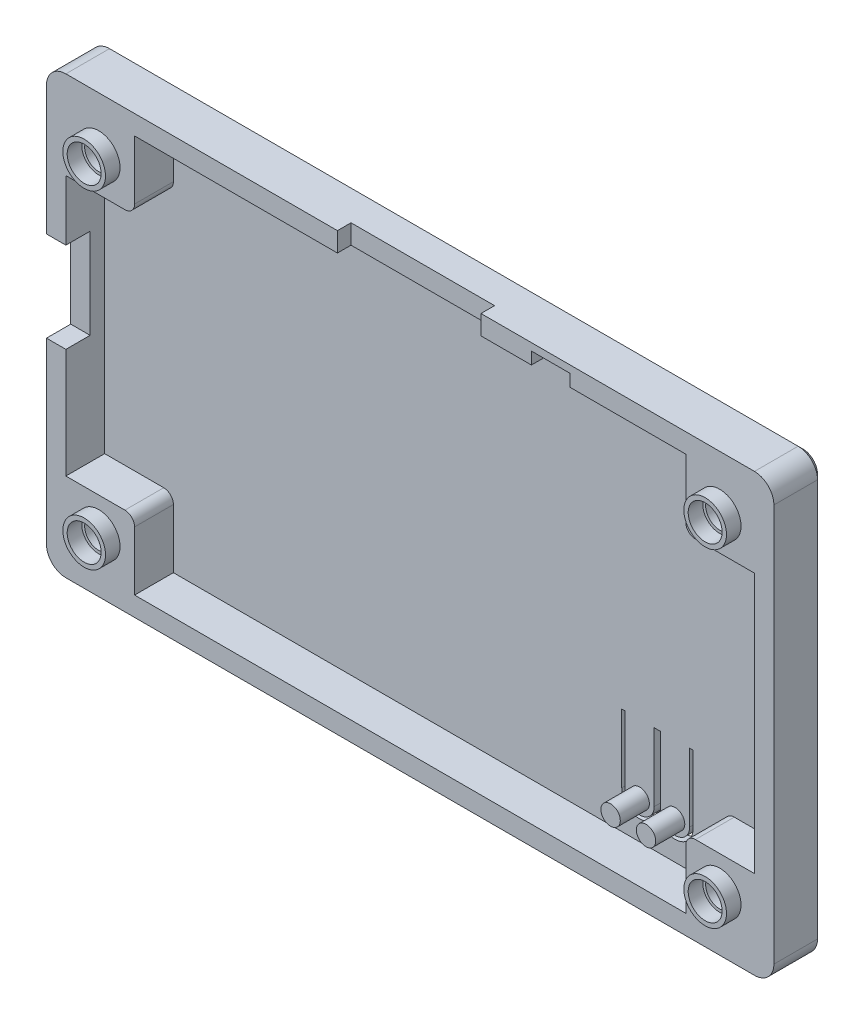
from build123d import *

# Parameters (mm, degrees)
SKICA1_W                  = 75
SKICA1_H                  = 45
P_IDAT_VYSUNUT_M1_DEPTH   = 13
SKICA2_W                  = 71
SKICA2_H                  = 41
ODEBRAT_VYSUNUT_M1_DEPTH  = 12
ZAOBLIT1_R                = 2
ZKOSEN_2_SIZE             = 0.5
SKICA4_W                  = 8.5
SKICA4_H                  = 8.5
P_IDAT_VYSUNUT_M2_DEPTH   = 4.22
ZAOBLIT2_R                = 1
SKICA6_W                  = 92.209043038
SKICA6_H                  = 16.914138174
ODEBRAT_VYSUNUT_M3_DEPTH  = 64.22
SKICA5_W                  = 10.08575576
SKICA5_H                  = 9.3
ODEBRAT_VYSUNUT_M4_DEPTH  = 10.5
SKICA7_W                  = 4
SKICA7_H                  = 7.545536299
ODEBRAT_VYSUNUT_M5_DEPTH  = 1.9
SKICA8_W                  = 14.8
SKICA8_H                  = 7.292326558
ODEBRAT_VYSUNUT_M6_DEPTH  = 1.4
SKICA9_R                  = 1.45
ODEBRAT_VYSUNUT_M7_DEPTH  = 5
SKICA10_R                 = 2.2
SKICA10_R_2               = 1.75
P_IDAT_VYSUNUT_M3_DEPTH   = 1.5
ODEBRAT_START             = -2
SKICA11_R                 = 2.925
SKICA11_R_2               = 1.45
ODEBRAT_VYSUNUT_M8_DEPTH  = 2
SKICA12_R                 = 1
P_IDAT_VYSUNUT_M4_DEPTH   = 3
ODEBRAT_VYSUNUT_M14_DEPTH = 1
ZKOSEN_3_SIZE             = 2
ZKOSEN_4_SIZE             = 2


with BuildPart() as part:
    # Skica1 → Přidat vysunutím1 (new body)
    with BuildSketch(Plane.XY):
        Rectangle(SKICA1_W, SKICA1_H)
    extrude(amount=P_IDAT_VYSUNUT_M1_DEPTH)

    # Skica2 → Odebrat vysunutím1 (cut)
    with BuildSketch(Plane.XY.offset(13)):
        Rectangle(SKICA2_W, SKICA2_H)
    extrude(amount=-ODEBRAT_VYSUNUT_M1_DEPTH, mode=Mode.SUBTRACT)

    # Zaoblit1
    zaoblit1_edges = [part.edges().sort_by_distance(p)[0] for p in [
        (35.5, 20.5, 7),
        (35.5, -20.5, 7),
        (-35.5, -20.5, 7),
        (-35.5, 20.5, 7),
        (37.5, -22.5, 6.5),
        (-37.5, -22.5, 6.5),
        (-37.5, 22.5, 6.5),
        (37.5, 22.5, 6.5),
    ]]
    fillet(zaoblit1_edges, radius=ZAOBLIT1_R)

    # Zkosení2
    zkosen_2_edges = [part.edges().sort_by_distance(p)[0] for p in [
        (0, 22.5, 0),
        (37.5, 0, 0),
        (0, -22.5, 0),
        (-37.5, 0, 0),
        (-36.914213562, 21.914213562, 0),
        (-36.914213562, -21.914213562, 0),
        (36.914213562, -21.914213562, 0),
        (36.914213562, 21.914213562, 0),
    ]]
    chamfer(zkosen_2_edges, length=ZKOSEN_2_SIZE)

    # Skica4 → Přidat vysunutím2 (add)
    with BuildSketch(Plane.XY.offset(1)):
        with Locations((-32.664213562, 17.664213562)):
            Rectangle(SKICA4_W, SKICA4_H)
        with Locations((-32.664213562, -17.664213562)):
            Rectangle(SKICA4_W, SKICA4_H)
        with Locations((32.664213562, -17.664213562)):
            Rectangle(SKICA4_W, SKICA4_H)
        with Locations((32.664213562, 17.664213562)):
            Rectangle(SKICA4_W, SKICA4_H)
    extrude(amount=P_IDAT_VYSUNUT_M2_DEPTH)

    # Zaoblit2
    zaoblit2_edges = [part.edges().sort_by_distance(p)[0] for p in [
        (-28.414213562, 13.414213562, 3.11),
        (-28.414213562, -13.414213562, 3.11),
        (28.414213562, -13.414213562, 3.11),
        (28.414213562, 13.414213562, 3.11),
    ]]
    fillet(zaoblit2_edges, radius=ZAOBLIT2_R)

    # Skica6 → Odebrat vysunutím3 (cut)
    with BuildSketch(Plane.XZ.offset(22.5)):
        with Locations((-2.449143373, 13.457069087)):
            Rectangle(SKICA6_W, SKICA6_H)
    extrude(amount=-ODEBRAT_VYSUNUT_M3_DEPTH, mode=Mode.SUBTRACT)

    # Skica5 → Odebrat vysunutím4 (cut)
    with BuildSketch(Plane.XY.offset(13)):
        with Locations((-37.618064514, 2.55)):
            Rectangle(SKICA5_W, SKICA5_H)
    extrude(amount=-ODEBRAT_VYSUNUT_M4_DEPTH, mode=Mode.SUBTRACT)

    # Skica7 → Odebrat vysunutím5 (cut)
    with BuildSketch(Plane.XY.offset(5)):
        with Locations((14.5, 17.977231851)):
            Rectangle(SKICA7_W, SKICA7_H)
    extrude(amount=-ODEBRAT_VYSUNUT_M5_DEPTH, mode=Mode.SUBTRACT)

    # Skica8 → Odebrat vysunutím6 (cut)
    with BuildSketch(Plane.XY.offset(5)):
        with Locations((-0.1, 20.570563513)):
            Rectangle(SKICA8_W, SKICA8_H)
    extrude(amount=-ODEBRAT_VYSUNUT_M6_DEPTH, mode=Mode.SUBTRACT)

    # Skica9 → Odebrat vysunutím7 (cut, symmetric)
    with BuildSketch(Plane.XY.offset(1)):
        with Locations(Location((-32.114213562, 16.914213562, 0), (0, 0, 180))):
            Circle(SKICA9_R)
        with Locations(Location((-32.114213562, -16.914213562, 0), (0, 0, 180))):
            Circle(SKICA9_R)
        with Locations(Location((31.914213562, -16.914213562, 0), (0, 0, 180))):
            Circle(SKICA9_R)
        with Locations(Location((31.914213562, 16.914213562, 0), (0, 0, 180))):
            Circle(SKICA9_R)
    extrude(amount=ODEBRAT_VYSUNUT_M7_DEPTH, both=True, mode=Mode.SUBTRACT)

    # Skica10 → Přidat vysunutím3 (add)
    # profile 1 of 4: a face of its own
    with BuildSketch(Plane.XY.offset(5)):
        with Locations(Location((31.914213562, 16.914213562, 0), (0, 0, 180))):
            Circle(SKICA10_R)
        with Locations((31.914213562, 16.914213562)):
            Circle(SKICA10_R_2, mode=Mode.SUBTRACT)
    # profile 2 of 4: a face of its own
    with BuildSketch(Plane.XY.offset(5)):
        with Locations(Location((31.914213562, -16.914213562, 0), (0, 0, 180))):
            Circle(SKICA10_R)
        with Locations((31.914213562, -16.914213562)):
            Circle(SKICA10_R_2, mode=Mode.SUBTRACT)
    # profile 3 of 4: a face of its own
    with BuildSketch(Plane.XY.offset(5)):
        with Locations(Location((-32.114213562, -16.914213562, 0), (0, 0, 180))):
            Circle(SKICA10_R)
        with Locations((-32.114213562, -16.914213562)):
            Circle(SKICA10_R_2, mode=Mode.SUBTRACT)
    # profile 4 of 4: a face of its own
    with BuildSketch(Plane.XY.offset(5)):
        with Locations(Location((-32.114213562, 16.914213562, 0), (0, 0, 180))):
            Circle(SKICA10_R)
        with Locations((-32.114213562, 16.914213562)):
            Circle(SKICA10_R_2, mode=Mode.SUBTRACT)
    extrude(amount=P_IDAT_VYSUNUT_M3_DEPTH)

    # Skica11 → Odebrat vysunutím8 (cut)
    # profile 1 of 4: a face of its own
    with BuildSketch(Plane(origin=(0, 0, 0), x_dir=(-1, 0, 0), z_dir=(0, 0, -1)).offset(ODEBRAT_START)):
        with Locations((32.114213562, -16.914213562)):
            Circle(SKICA11_R)
        with Locations((32.114213562, -16.914213562)):
            Circle(SKICA11_R_2, mode=Mode.SUBTRACT)
    # profile 2 of 4: a face of its own
    with BuildSketch(Plane(origin=(0, 0, 0), x_dir=(-1, 0, 0), z_dir=(0, 0, -1)).offset(ODEBRAT_START)):
        with Locations((-31.914213562, -16.914213562)):
            Circle(SKICA11_R)
        with Locations((-31.914213562, -16.914213562)):
            Circle(SKICA11_R_2, mode=Mode.SUBTRACT)
    # profile 3 of 4: a face of its own
    with BuildSketch(Plane(origin=(0, 0, 0), x_dir=(-1, 0, 0), z_dir=(0, 0, -1)).offset(ODEBRAT_START)):
        with Locations((-31.914213562, 16.914213562)):
            Circle(SKICA11_R)
        with Locations((-31.914213562, 16.914213562)):
            Circle(SKICA11_R_2, mode=Mode.SUBTRACT)
    # profile 4 of 4: a face of its own
    with BuildSketch(Plane(origin=(0, 0, 0), x_dir=(-1, 0, 0), z_dir=(0, 0, -1)).offset(ODEBRAT_START)):
        with Locations((32.114213562, 16.914213562)):
            Circle(SKICA11_R)
        with Locations((32.114213562, 16.914213562)):
            Circle(SKICA11_R_2, mode=Mode.SUBTRACT)
    extrude(amount=ODEBRAT_VYSUNUT_M8_DEPTH, mode=Mode.SUBTRACT)

    # Skica12 → Přidat vysunutím4 (add)
    with BuildSketch(Plane.XY.offset(1)):
        with Locations(Location((23.314213562, -16.6, 0), (0, 0, 180))):
            Circle(SKICA12_R)
        with Locations(Location((19.664213562, -16.6, 0), (0, 0, 180))):
            Circle(SKICA12_R)
    extrude(amount=P_IDAT_VYSUNUT_M4_DEPTH)

    # Skica13 → Odebrat vysunutím14 (cut)
    with BuildSketch(Plane.XY.offset(1)):
        with BuildLine():
            ThreePointArc((24.814213562, -16.6), (23.314213562, -18.1), (21.814213562, -16.6))
            Line((21.814213562, -16.6), (21.814213562, -9.556250206))
            Line((21.814213562, -9.556250206), (21.514213562, -9.556250206))
            Line((21.514213562, -9.556250206), (21.464213562, -9.556250206))
            Line((21.464213562, -9.556250206), (21.164213562, -9.556250206))
            Line((21.164213562, -9.556250206), (21.164213562, -16.6))
            ThreePointArc((21.164213562, -16.6), (19.664213562, -18.1), (18.164213562, -16.6))
            Line((18.164213562, -16.6), (18.164213562, -9.556250206))
            Line((18.164213562, -9.556250206), (17.814213562, -9.556250206))
            Line((17.814213562, -9.556250206), (17.814213562, -16.6))
            ThreePointArc((17.814213562, -16.6), (19.512144499, -18.443739407), (21.489213562, -16.903108891))
            ThreePointArc((21.489213562, -16.903108891), (23.466282626, -18.443739407), (25.164213562, -16.6))
            Line((25.164213562, -16.6), (25.164213562, -9.556250206))
            Line((25.164213562, -9.556250206), (24.814213562, -9.556250206))
            Line((24.814213562, -9.556250206), (24.814213562, -16.6))
        make_face()
    extrude(amount=-ODEBRAT_VYSUNUT_M14_DEPTH, mode=Mode.SUBTRACT)

    # Zkosení3
    # the kernel refuses this chamfer: 2 mm, written as the material it takes off along each edge
    with BuildSketch(Plane(origin=(31.914213562, 16.914213562, 2), x_dir=(-1, 0, 0), z_dir=(0, -1, 0))) as zkosen_3_piece_1_section:
        Polygon((1.45 + ZKOSEN_3_SIZE, 0), (1.45, -ZKOSEN_3_SIZE), (1.45, 0), align=None)
    zkosen_3_piece_1 = revolve(axis=Axis((31.914213562, 16.914213562, 2), (0, 0, -1)), mode=Mode.PRIVATE)
    zkosen_3_piece_1 = zkosen_3_piece_1 & Plane(origin=(31.914213562, 16.914213562, 3.26993651), x_dir=(-1, 0, 0), z_dir=(0, 0, 1)) * Cylinder(2.925, 14, mode=Mode.PRIVATE)
    add(zkosen_3_piece_1, mode=Mode.SUBTRACT)
    with BuildSketch(Plane(origin=(-32.114213562, -16.914213562, 2), x_dir=(-1, 0, 0), z_dir=(0, -1, 0))) as zkosen_3_piece_2_section:
        Polygon((1.45 + ZKOSEN_3_SIZE, 0), (1.45, -ZKOSEN_3_SIZE), (1.45, 0), align=None)
    zkosen_3_piece_2 = revolve(axis=Axis((-32.114213562, -16.914213562, 2), (0, 0, -1)), mode=Mode.PRIVATE)
    zkosen_3_piece_2 = zkosen_3_piece_2 & Plane(origin=(-32.114213562, -16.914213562, 3.26993651), x_dir=(-1, 0, 0), z_dir=(0, 0, 1)) * Cylinder(2.925, 14, mode=Mode.PRIVATE)
    add(zkosen_3_piece_2, mode=Mode.SUBTRACT)

    # Zkosení4
    # the kernel refuses this chamfer: 2 mm, written as the material it takes off along each edge
    with BuildSketch(Plane(origin=(31.914213562, -16.914213562, 2), x_dir=(-1, 0, 0), z_dir=(0, -1, 0))) as zkosen_4_piece_1_section:
        Polygon((1.45 + ZKOSEN_4_SIZE, 0), (1.45, -ZKOSEN_4_SIZE), (1.45, 0), align=None)
    zkosen_4_piece_1 = revolve(axis=Axis((31.914213562, -16.914213562, 2), (0, 0, -1)), mode=Mode.PRIVATE)
    zkosen_4_piece_1 = zkosen_4_piece_1 & Plane(origin=(31.914213562, -16.914213562, 3.26993651), x_dir=(-1, 0, 0), z_dir=(0, 0, 1)) * Cylinder(2.925, 14, mode=Mode.PRIVATE)
    add(zkosen_4_piece_1, mode=Mode.SUBTRACT)
    with BuildSketch(Plane(origin=(-32.114213562, 16.914213562, 2), x_dir=(-1, 0, 0), z_dir=(0, -1, 0))) as zkosen_4_piece_2_section:
        Polygon((1.45 + ZKOSEN_4_SIZE, 0), (1.45, -ZKOSEN_4_SIZE), (1.45, 0), align=None)
    zkosen_4_piece_2 = revolve(axis=Axis((-32.114213562, 16.914213562, 2), (0, 0, -1)), mode=Mode.PRIVATE)
    zkosen_4_piece_2 = zkosen_4_piece_2 & Plane(origin=(-32.114213562, 16.914213562, 3.26993651), x_dir=(-1, 0, 0), z_dir=(0, 0, 1)) * Cylinder(2.925, 14, mode=Mode.PRIVATE)
    add(zkosen_4_piece_2, mode=Mode.SUBTRACT)


solid = part.part
